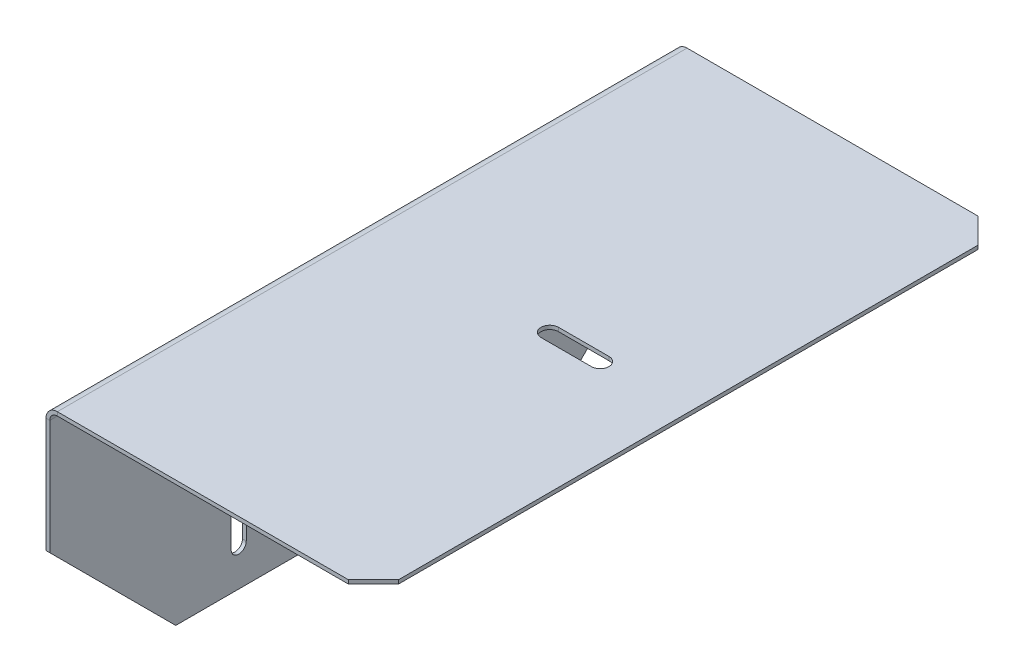
from build123d import *

# Parameters (mm, degrees)
BASE_FLANGE1_DEPTH = 250
CUT_EXTRUDE1_DEPTH = 10
CHAMFER1_SIZE      = 10
CUT_EXTRUDE3_DEPTH = 10
CHAMFER2_SIZE      = 50


# Sheet-metal steps are written as plain solids
with BuildPart() as part:
    # Sketch1 → Base-Flange1 (new body)
    with BuildSketch(Plane.XY):
        with BuildLine():
            Line((0, 0), (0, 95.5))
            ThreePointArc((0, 95.5), (1.318019485, 98.681980515), (4.5, 100))
            Line((4.5, 100), (130, 100))
            Line((130, 100), (130, 98.5))
            Line((130, 98.5), (4.5, 98.5))
            ThreePointArc((4.5, 98.5), (2.378679656, 97.621320344), (1.5, 95.5))
            Line((1.5, 95.5), (1.5, 0))
            Line((1.5, 0), (0, 0))
        make_face()
    extrude(amount=BASE_FLANGE1_DEPTH)

    # Sketch6 → Cut-Extrude1 (cut)
    with BuildSketch(Plane(origin=(0, 100, 0), x_dir=(1, 0, 0), z_dir=(0, 1, 0))):
        with BuildLine():
            Line((95, -128.5), (75, -128.5))
            ThreePointArc((75, -128.5), (71.5, -125), (75, -121.5))
            Line((75, -121.5), (95, -121.5))
            ThreePointArc((95, -121.5), (98.5, -125), (95, -128.5))
        make_face()
    extrude(amount=-CUT_EXTRUDE1_DEPTH, mode=Mode.SUBTRACT)

    # Chamfer1
    chamfer1_edges = [part.edges().sort_by_distance(p)[0] for p in [
        (130, 99.25, 250),
        (130, 99.25, 0),
    ]]
    chamfer(chamfer1_edges, length=CHAMFER1_SIZE)

    # Sketch9 → Cut-Extrude3 (cut)
    with BuildSketch(Plane(origin=(1.5, 0, 0), x_dir=(0, 0, -1), z_dir=(1, 0, 0))):
        with BuildLine():
            Line((-178, 15), (-178, 80))
            ThreePointArc((-178, 80), (-175, 83), (-172, 80))
            Line((-172, 80), (-172, 15))
            ThreePointArc((-172, 15), (-175, 12), (-178, 15))
        make_face()
        with BuildLine():
            Line((-78, 15), (-78, 80))
            ThreePointArc((-78, 80), (-75, 83), (-72, 80))
            Line((-72, 80), (-72, 15))
            ThreePointArc((-72, 15), (-75, 12), (-78, 15))
        make_face()
    extrude(amount=-CUT_EXTRUDE3_DEPTH, mode=Mode.SUBTRACT)

    # Chamfer2
    chamfer2_edges = [part.edges().sort_by_distance(p)[0] for p in [
        (0.75, 0, 250),
        (0.75, 0, 0),
    ]]
    chamfer(chamfer2_edges, length=CHAMFER2_SIZE)


solid = part.part
